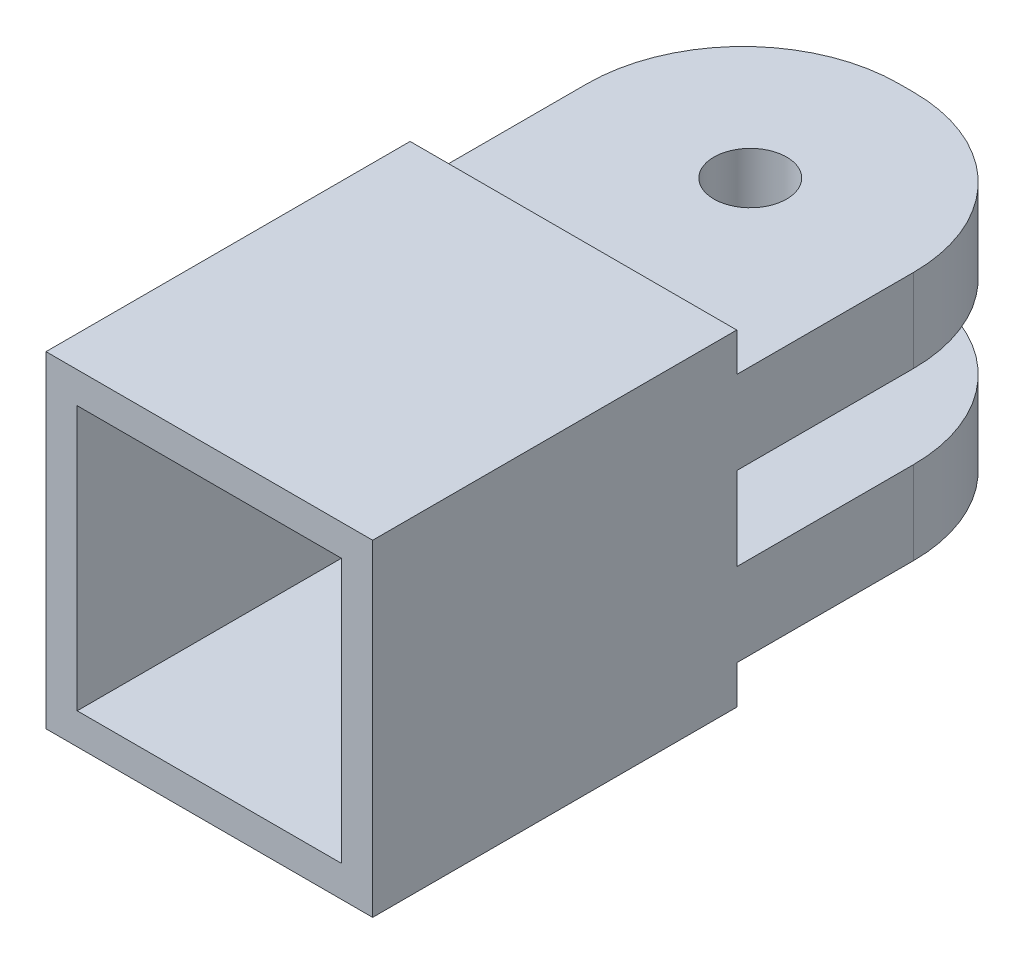
from build123d import *

# Parameters (mm, degrees)
SKETCH1_W           = 31.4
SKETCH1_H           = 31.4
SKETCH1_W_2         = 25.4
SKETCH1_H_2         = 25.4
BOSS_EXTRUDE1_DEPTH = 30
SKETCH2_W           = 31.4
SKETCH2_H           = 31.4
BOSS_EXTRUDE2_DEPTH = 5
SKETCH3_W           = 31.4
SKETCH3_H           = 8
BOSS_EXTRUDE3_DEPTH = 5
SKETCH6_R           = 3.5
BOSS_EXTRUDE6_DEPTH = 8


with BuildPart() as part:
    # Sketch1 → Boss-Extrude1 (new body)
    with BuildSketch(Plane.XY):
        Rectangle(SKETCH1_W, SKETCH1_H)
        Rectangle(SKETCH1_W_2, SKETCH1_H_2, mode=Mode.SUBTRACT)
    extrude(amount=BOSS_EXTRUDE1_DEPTH)

    # Sketch2 → Boss-Extrude2 (add)
    with BuildSketch(Plane(origin=(0, 0, 0), x_dir=(-1, 0, 0), z_dir=(0, 0, -1))):
        Rectangle(SKETCH2_W, SKETCH2_H)
    extrude(amount=BOSS_EXTRUDE2_DEPTH)

    # Sketch3 → Boss-Extrude3 (add)
    with BuildSketch(Plane(origin=(0, 0, -5), x_dir=(-1, 0, 0), z_dir=(0, 0, -1))):
        with Locations((0, 8)):
            Rectangle(SKETCH3_W, SKETCH3_H)
    boss_extrude3 = extrude(amount=BOSS_EXTRUDE3_DEPTH)

    # Sketch6 → Boss-Extrude6 (add)
    with BuildSketch(Plane(origin=(0, 12, 0), x_dir=(1, 0, 0), z_dir=(0, 1, 0))):
        with BuildLine():
            Line((-15.7, 10), (-15.7, 22))
            ThreePointArc((-15.7, 22), (-11.306601718, 32.606601718), (-0.7, 37))
            Line((-0.7, 37), (0.7, 37))
            ThreePointArc((0.7, 37), (11.306601718, 32.606601718), (15.7, 22))
            Line((15.7, 22), (15.7, 10))
            Line((15.7, 10), (-15.7, 10))
        make_face()
        with Locations((0, 22)):
            Circle(SKETCH6_R, mode=Mode.SUBTRACT)
    boss_extrude6 = extrude(amount=-BOSS_EXTRUDE6_DEPTH)

    # Mirror1: Boss-Extrude3, Boss-Extrude6 across plane
    add(boss_extrude3.mirror(Plane.ZX))
    add(boss_extrude6.mirror(Plane.ZX))


solid = part.part
